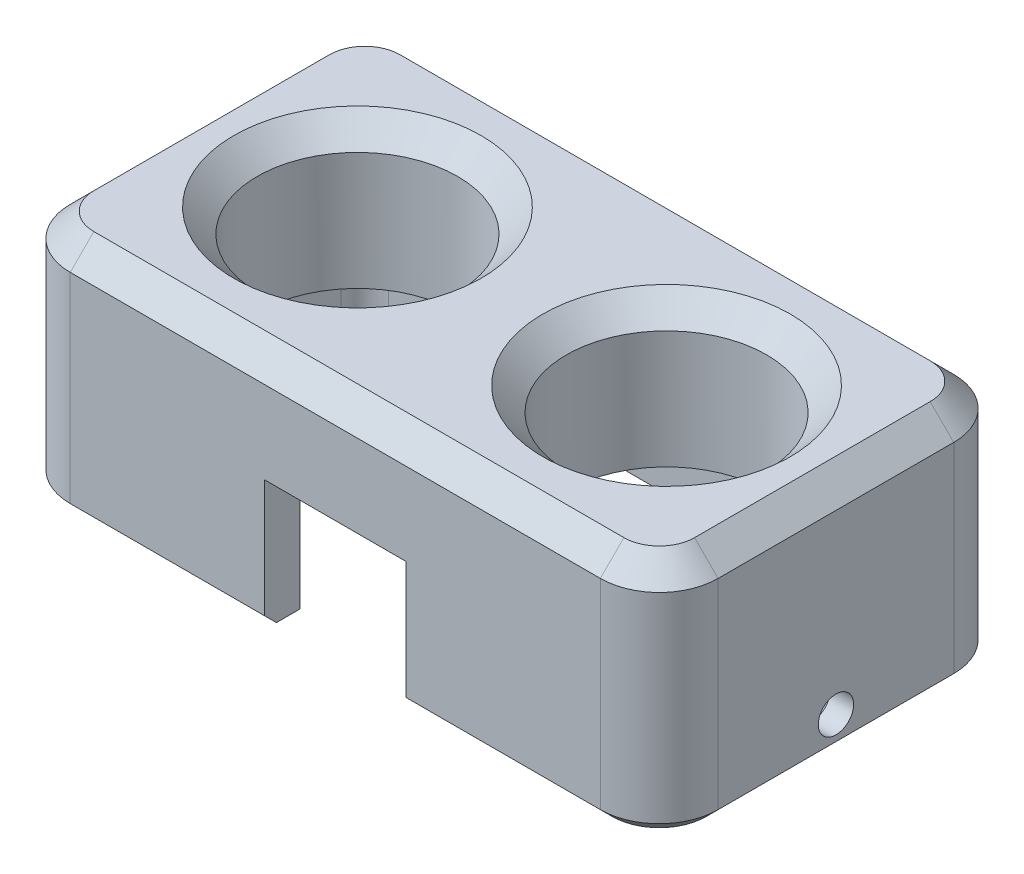
from build123d import *

# Parameters (mm, degrees)
SKETCH1_W                       = 55
SKETCH1_H                       = 30
BOSS_EXTRUDE1_DEPTH             = 12
SKETCH2_R                       = 8.5
CUT_EXTRUDE1_DEPTH              = 34.544746235
SKETCH5_W                       = 12
SKETCH5_H                       = 9
CUT_EXTRUDE3_DEPTH              = 3
FILLET2_R                       = 5
BOSS_EXTRUDE3_DEPTH             = 8
F_3_0MM_DOWEL_HOLE1_D           = 3
SKETCH10_W                      = 8
SKETCH10_H                      = 8
BOSS_EXTRUDE4_DEPTH             = 1
TAP_DRILL_FOR_M2X0_4_TAP1_D     = 1.6
TAP_DRILL_FOR_M2X0_4_TAP1_DEPTH = 5
TAP_DRILL_FOR_M2X0_4_TAP1_TIP   = 0.480688495
CUT_EXTRUDE4_DEPTH              = 2
CHAMFER1_SIZE                   = 2
CHAMFER2_SIZE                   = 1


with BuildPart() as part:
    # Sketch1 → Boss-Extrude1 (new body)
    with BuildSketch(Plane(origin=(0, 0, 0), x_dir=(1, 0, 0), z_dir=(0, 1, 0))):
        Rectangle(SKETCH1_W, SKETCH1_H)
    extrude(amount=BOSS_EXTRUDE1_DEPTH)

    # Sketch2 → Cut-Extrude1 (cut, through all)
    with BuildSketch(Plane(origin=(0, 12, 0), x_dir=(1, 0, 0), z_dir=(0, 1, 0))):
        with Locations((-13.12, 0)):
            Circle(SKETCH2_R)
        with Locations((13.12, 0)):
            Circle(SKETCH2_R)
    extrude(amount=-CUT_EXTRUDE1_DEPTH, mode=Mode.SUBTRACT)

    # Sketch5 → Cut-Extrude3 (cut)
    with BuildSketch(Plane.XZ):
        with Locations((0, 10.5)):
            Rectangle(SKETCH5_W, SKETCH5_H)
    extrude(amount=-CUT_EXTRUDE3_DEPTH, mode=Mode.SUBTRACT)

    # Fillet2
    fillet2_edges = [part.edges().sort_by_distance(p)[0] for p in [
        (27.5, 6, 15),
        (-27.5, 6, -15),
        (27.5, 6, -15),
        (-27.5, 6, 15),
    ]]
    fillet(fillet2_edges, radius=FILLET2_R)

    # Sketch6 → Boss-Extrude3 (add)
    with BuildSketch(Plane.XZ):
        with BuildLine():
            Line((24.5, 10), (24.5, -10))
            ThreePointArc((24.5, -10), (23.914213562, -11.414213562), (22.5, -12))
            Line((22.5, -12), (-22.5, -12))
            ThreePointArc((-22.5, -12), (-23.914213562, -11.414213562), (-24.5, -10))
            Line((-24.5, -10), (-24.5, 10))
            ThreePointArc((-24.5, 10), (-23.914213562, 11.414213562), (-22.5, 12))
            Line((-22.5, 12), (-9, 12))
            Line((-9, 12), (-6, 12))
            Line((-6, 12), (-6, 15))
            Line((-6, 15), (-22.5, 15))
            ThreePointArc((-22.5, 15), (-26.035533906, 13.535533906), (-27.5, 10))
            Line((-27.5, 10), (-27.5, -10))
            ThreePointArc((-27.5, -10), (-26.035533906, -13.535533906), (-22.5, -15))
            Line((-22.5, -15), (22.5, -15))
            ThreePointArc((22.5, -15), (26.035533906, -13.535533906), (27.5, -10))
            Line((27.5, -10), (27.5, 10))
            ThreePointArc((27.5, 10), (26.035533906, 13.535533906), (22.5, 15))
            Line((22.5, 15), (6, 15))
            Line((6, 15), (6, 12))
            Line((6, 12), (9, 12))
            Line((9, 12), (22.5, 12))
            ThreePointArc((22.5, 12), (23.914213562, 11.414213562), (24.5, 10))
        make_face()
    extrude(amount=BOSS_EXTRUDE3_DEPTH)

    # Ø3.0mm Dowel Hole1 (through all)
    with Locations(Plane.ZY.offset(27.5)):
        with Locations((0, -5)):
            Hole(F_3_0MM_DOWEL_HOLE1_D / 2)

    # Sketch10 → Boss-Extrude4 (add)
    with BuildSketch(Plane.ZY.offset(-24.5)):
        with Locations((0, -4)):
            Rectangle(SKETCH10_W, SKETCH10_H)
        Polygon((2.886751346, -5), (1.443375673, -2.5), (-1.443375673, -2.5), (-2.886751346, -5), (-1.443375673, -7.5), (1.443375673, -7.5), align=None, mode=Mode.SUBTRACT)
    boss_extrude4 = extrude(amount=BOSS_EXTRUDE4_DEPTH)

    # Mirror1: Boss-Extrude4 across plane
    add(boss_extrude4.mirror(Plane(origin=(0, 0, 0), x_dir=(0, 0, 1), z_dir=(1, 0, 0))))

    # Tap Drill for M2x0.4 Tap1
    with Locations(Plane(origin=(0, 0, 0), x_dir=(-1, 0, 0), z_dir=(0, -1, 0))):
        with Locations((-21.15, 8.5), (21.15, 8.5), (21.15, -8.5), (-21.15, -8.5)):
            Hole(TAP_DRILL_FOR_M2X0_4_TAP1_D / 2, depth=TAP_DRILL_FOR_M2X0_4_TAP1_DEPTH)
            with Locations((0, 0, -(TAP_DRILL_FOR_M2X0_4_TAP1_DEPTH + TAP_DRILL_FOR_M2X0_4_TAP1_TIP / 2))):  # 118° drill point
                Cone(0, TAP_DRILL_FOR_M2X0_4_TAP1_D / 2, TAP_DRILL_FOR_M2X0_4_TAP1_TIP, mode=Mode.SUBTRACT)

    # Sketch13 → Cut-Extrude4 (cut)
    with BuildSketch(Plane.ZY.offset(-23.5)):
        Polygon((2.886751346, -5), (1.443375673, -2.5), (-1.443375673, -2.5), (-2.886751346, -5), (-1.443375673, -7.5), (1.443375673, -7.5), align=None)
    cut_extrude4 = extrude(amount=-CUT_EXTRUDE4_DEPTH, mode=Mode.SUBTRACT)

    # Mirror2: Cut-Extrude4 across plane
    add(cut_extrude4.mirror(Plane(origin=(0, 0, 0), x_dir=(0, 0, 1), z_dir=(1, 0, 0))), mode=Mode.SUBTRACT)

    # Chamfer1
    chamfer1_edges = [part.edges().sort_by_distance(p)[0] for p in [
        (-21.62, 12, 0),
        (4.62, 12, 0),
        (-26.035533906, 12, 13.535533906),
        (-27.5, 12, 0),
        (-26.035533906, 12, -13.535533906),
        (0, 12, -15),
        (26.035533906, 12, -13.535533906),
        (27.5, 12, 0),
        (26.035533906, 12, 13.535533906),
        (0, 12, 15),
    ]]
    chamfer(chamfer1_edges, length=CHAMFER1_SIZE)

    # Chamfer2
    chamfer2_edges = [part.edges().sort_by_distance(p)[0] for p in [
        (-26.035533906, -8, 13.535533906),
        (-14.25, -8, 15),
    ]]
    chamfer(chamfer2_edges, length=CHAMFER2_SIZE)


solid = part.part
